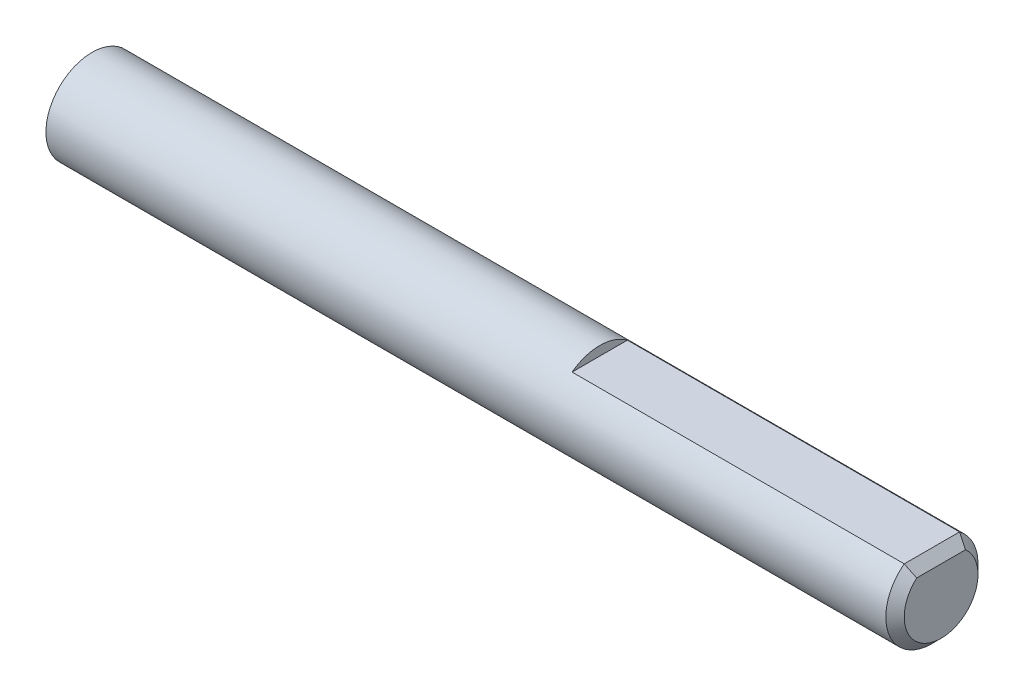
from build123d import *

# Parameters (mm, degrees)
SKETCH1_R           = 2.5
BOSS_EXTRUDE1_DEPTH = 46.04
SKETCH3_W           = 18.51
SKETCH3_H           = 3
CUT_EXTRUDE1_DEPTH  = 0.5
CHAMFER1_SIZE       = 0.5


with BuildPart() as part:
    # Sketch1 → Boss-Extrude1 (new body)
    with BuildSketch(Plane(origin=(0, 0, 0), x_dir=(0, 0, -1), z_dir=(1, 0, 0))):
        Circle(SKETCH1_R)
    extrude(amount=BOSS_EXTRUDE1_DEPTH)

    # Sketch3 → Cut-Extrude1 (cut)
    with BuildSketch(Plane(origin=(0, 2.5, 0), x_dir=(1, 0, 0), z_dir=(0, 1, 0))):
        with Locations((36.785, 0)):
            Rectangle(SKETCH3_W, SKETCH3_H)
    extrude(amount=-CUT_EXTRUDE1_DEPTH, mode=Mode.SUBTRACT)

    # Chamfer1
    chamfer1_edges = [part.edges().sort_by_distance(p)[0] for p in [
        (46.04, -2.236067977, 1.118033989),
        (46.04, 2, 0),
    ]]
    chamfer(chamfer1_edges, length=CHAMFER1_SIZE - 0.0001)  # a hair under: the kernel refuses the full size


solid = part.part
